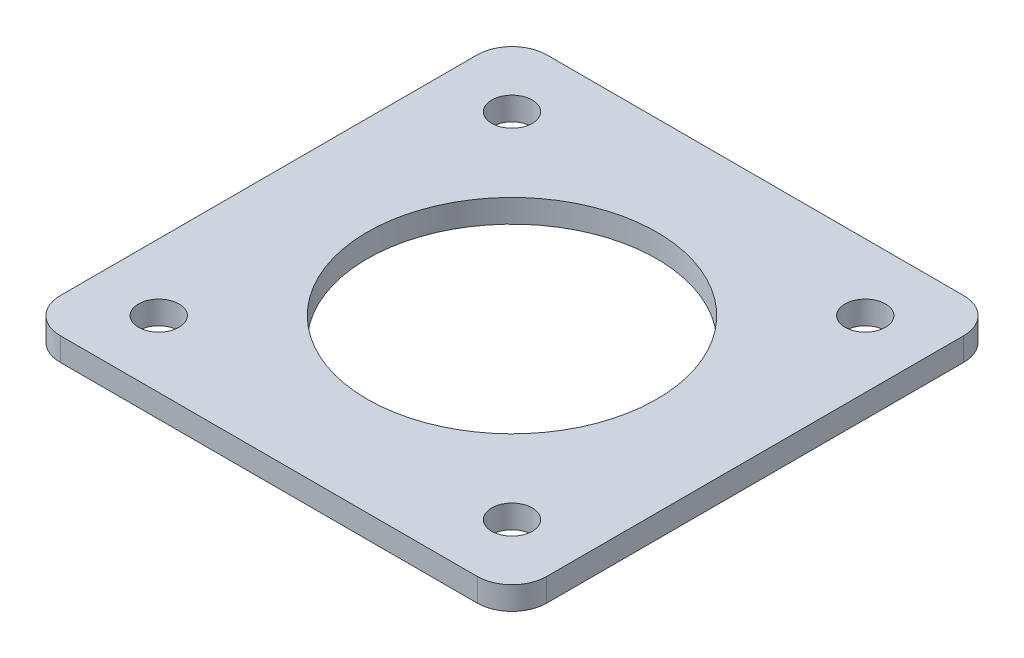
from build123d import *

# Parameters (mm, degrees)
SZKIC1_R                    = 12.5
SZKIC1_R_2                  = 1.75
DODANIE_WYCI_GNI_CIE1_DEPTH = 2


with BuildPart() as part:
    # Szkic1 → Dodanie-wyciągnięcie1 (new body)
    with BuildSketch(Plane(origin=(0, 0, 0), x_dir=(1, 0, 0), z_dir=(0, 1, 0))):
        with BuildLine():
            Line((3, 0), (39, 0))
            ThreePointArc((39, 0), (41.121320344, 0.878679656), (42, 3))
            Line((42, 3), (42, 39))
            ThreePointArc((42, 39), (41.121320344, 41.121320344), (39, 42))
            Line((39, 42), (3, 42))
            ThreePointArc((3, 42), (0.878679656, 41.121320344), (0, 39))
            Line((0, 39), (0, 3))
            ThreePointArc((0, 3), (0.878679656, 0.878679656), (3, 0))
        make_face()
        with Locations((21, 21)):
            Circle(SZKIC1_R, mode=Mode.SUBTRACT)
        with Locations((5.75, 36.25)):
            Circle(SZKIC1_R_2, mode=Mode.SUBTRACT)
        with Locations((36.25, 36.25)):
            Circle(SZKIC1_R_2, mode=Mode.SUBTRACT)
        with Locations((36.25, 5.75)):
            Circle(SZKIC1_R_2, mode=Mode.SUBTRACT)
        with Locations((5.75, 5.75)):
            Circle(SZKIC1_R_2, mode=Mode.SUBTRACT)
    extrude(amount=DODANIE_WYCI_GNI_CIE1_DEPTH)


solid = part.part
